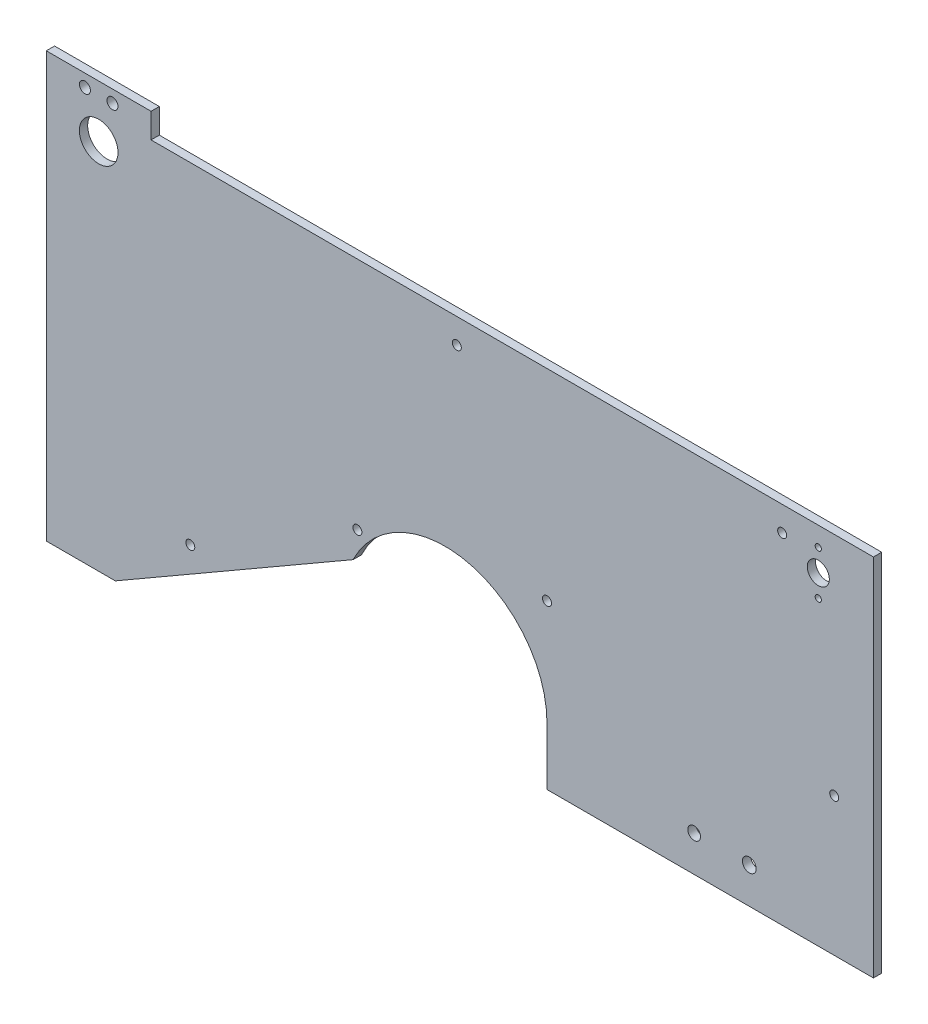
from build123d import *

# Parameters (mm, degrees)
SKETCH2_R           = 7
SKETCH2_R_2         = 2
BOSS_EXTRUDE2_DEPTH = 3
SKETCH3_W           = 118.4
SKETCH3_H           = 12.75
CUT_EXTRUDE1_DEPTH  = 338.231374578
SKETCH5_R           = 2.5
SKETCH5_R_2         = 2.306063735
SKETCH5_R_3         = 4
SKETCH5_R_4         = 1.125
SKETCH5_R_5         = 1.625
CUT_EXTRUDE2_DEPTH  = 338.231374578


with BuildPart() as part:
    # Sketch2 → Boss-Extrude2 (new body)
    with BuildSketch(Plane.XY):
        with BuildLine():
            Line((25.03035901, 0), (111.286489227, 49.8))
            ThreePointArc((111.286489227, 49.8), (152.858332199, 69.766604349), (181.6, 33.7))
            Line((181.6, 33.7), (181.6, 0))
            Line((181.6, 0), (300, 0))
            Line((300, 0), (300, 145))
            Line((300, 145), (38, 145))
            Line((38, 145), (38, 154))
            Line((38, 154), (19, 154))
            Line((19, 154), (0, 154))
            Line((0, 154), (0, 0))
            Line((0, 0), (25.03035901, 0))
        make_face()
        with Locations((19, 135)):
            Circle(SKETCH2_R, mode=Mode.SUBTRACT)
        with Locations((14, 149.5)):
            Circle(SKETCH2_R_2, mode=Mode.SUBTRACT)
        with Locations((24, 149.5)):
            Circle(SKETCH2_R_2, mode=Mode.SUBTRACT)
    extrude(amount=BOSS_EXTRUDE2_DEPTH)

    # Sketch3 → Cut-Extrude1 (cut, through all)
    with BuildSketch(Plane.XY.offset(3)):
        with Locations((240.8, 6.375)):
            Rectangle(SKETCH3_W, SKETCH3_H)
    extrude(amount=-CUT_EXTRUDE1_DEPTH, mode=Mode.SUBTRACT)

    # Sketch5 → Cut-Extrude2 (cut, through all)
    with BuildSketch(Plane.XY.offset(3)):
        with Locations((254.98, 25.75)):
            Circle(SKETCH5_R)
        with Locations((234.98, 25.75)):
            Circle(SKETCH5_R_2)
        with Locations((280, 130)):
            Circle(SKETCH5_R_3)
        with Locations((280, 138)):
            Circle(SKETCH5_R_4)
        with Locations((280, 122)):
            Circle(SKETCH5_R_4)
        with Locations((285.78, 62.92)):
            Circle(SKETCH5_R_5)
        with Locations((181.6, 72.03)):
            Circle(SKETCH5_R_5)
        with Locations((52.23, 24.91)):
            Circle(SKETCH5_R_5)
        with Locations((112.84, 59.93)):
            Circle(SKETCH5_R_5)
        with Locations((266.895, 135.995)):
            Circle(SKETCH5_R_5)
        with Locations((148.895, 135.995)):
            Circle(SKETCH5_R_5)
    extrude(amount=-CUT_EXTRUDE2_DEPTH, mode=Mode.SUBTRACT)


solid = part.part
